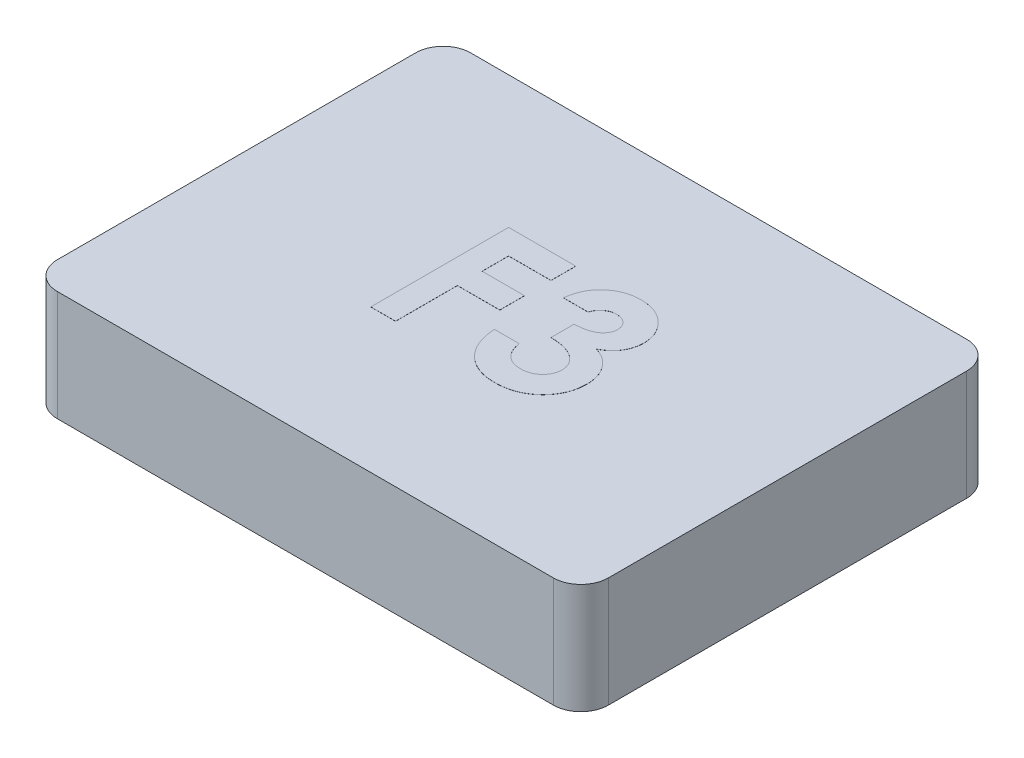
from build123d import *

# Parameters (mm, degrees)
SKETCH1_W           = 12.7
SKETCH1_H           = 9.525
BOSS_EXTRUDE1_DEPTH = 2.54
FILLET1_R           = 0.635
SHELL1_START        = 0.635
SHELL1_OUTLINE_W    = 1.905
SHELL1_OUTLINE_H    = 8.255
SHELL1_DEPTH        = 11.43
SKETCH2_R           = 2.54
BOSS_EXTRUDE2_DEPTH = 1.905
BOSS_EXTRUDE3_DEPTH = 0.00254


# Read off the part's stored shape, not the designer's step: Shell1
with BuildPart() as part:
    # Sketch1 → Boss-Extrude1 (new body)
    with BuildSketch(Plane(origin=(0, 0, 0), x_dir=(1, 0, 0), z_dir=(0, 1, 0))):
        with Locations((6.35, 4.7625)):
            Rectangle(SKETCH1_W, SKETCH1_H)
    extrude(amount=BOSS_EXTRUDE1_DEPTH)

    # Fillet1
    fillet1_edges = [part.edges().sort_by_distance(p)[0] for p in [
        (0, 1.27, -9.525),
        (12.7, 1.27, -9.525),
        (12.7, 1.27, 0),
        (0, 1.27, 0),
    ]]
    fillet(fillet1_edges, radius=FILLET1_R)

    # Shell1 outline → Shell1 (cut)
    with BuildSketch(Plane.YZ.offset(SHELL1_START)):
        with Locations((0.9525, -4.7625)):
            Rectangle(SHELL1_OUTLINE_W, SHELL1_OUTLINE_H)
    extrude(amount=SHELL1_DEPTH, mode=Mode.SUBTRACT)

    # Sketch2 → Boss-Extrude2 (add)
    with BuildSketch(Plane(origin=(0, 1.905, 0), x_dir=(-1, 0, 0), z_dir=(0, -1, 0))):
        with Locations(Location((-6.35, 4.7625, 0), (0, 0, 270))):
            Circle(SKETCH2_R)
    extrude(amount=BOSS_EXTRUDE2_DEPTH)

    # Sketch3 → Boss-Extrude3 (add)
    with BuildSketch(Plane(origin=(0, 2.54, 0), x_dir=(1, 0, 0), z_dir=(0, 1, 0))):
        Polygon((4.557346154, 6.477), (6.104141026, 6.477), (6.104141026, 5.907128205), (5.127217949, 5.907128205), (5.127217949, 5.296551282), (6.104141026, 5.296551282), (6.104141026, 4.726679487), (5.127217949, 4.726679487), (5.127217949, 3.302), (4.557346154, 3.302), align=None)
        with BuildLine():
            Line((7.162474359, 5.703602564), (6.592602564, 5.703602564))
            add(Edge.make_bspline(
                [(6.592602564, 5.703602564), (6.596626076, 5.732088422), (6.604513904, 5.78793306), (6.623388421, 5.868782184), (6.645964381, 5.945473111), (6.674149313, 6.017762976), (6.707205653, 6.085780553), (6.744797255, 6.149759244), (6.787330498, 6.20942444), (6.81993268, 6.245366991), (6.836197316, 6.263298077)],
                knots=[0, 0, 0, 0, 1.111473889, 2.178970933, 3.205615836, 4.199322666, 5.174200091, 6.12565194, 7.064921805, 8, 8, 8, 8], degree=3))
            add(Edge.make_bspline(
                [(6.836197316, 6.263298077), (6.859656898, 6.286956845), (6.905893269, 6.333585791), (6.983159668, 6.39331232), (7.064149124, 6.44500157), (7.150485915, 6.48598118), (7.240826576, 6.519149428), (7.335889528, 6.541428614), (7.435286308, 6.556211051), (7.503112106, 6.557667173), (7.53772476, 6.558410256)],
                knots=[0, 0, 0, 0, 1.01925491, 2.00884431, 2.983262333, 3.955970413, 4.92937149, 5.924503185, 6.940838805, 8, 8, 8, 8], degree=3))
            add(Edge.make_bspline(
                [(7.53772476, 6.558410256), (7.56849719, 6.55768378), (7.628989587, 6.556255673), (7.71789819, 6.544791605), (7.802665103, 6.524684907), (7.884186336, 6.49839585), (7.961262978, 6.462625195), (8.035596185, 6.421103078), (8.105109084, 6.370174475), (8.169964323, 6.31263028), (8.22954623, 6.2503906), (8.281144422, 6.1838615), (8.325504313, 6.114820126), (8.362050997, 6.042692875), (8.39015043, 5.9673577), (8.40965227, 5.8892498), (8.422416697, 5.808541527), (8.423688368, 5.753685202), (8.424333333, 5.725863181)],
                knots=[0, 0, 0, 0, 1.091422571, 2.145516843, 3.172569842, 4.178562979, 5.178154469, 6.181868002, 7.194278174, 8.227918432, 9.254613415, 10.245994977, 11.209837596, 12.161663635, 13.10878368, 14.055455738, 15.013766427, 16, 16, 16, 16], degree=3))
            add(Edge.make_bspline(
                [(8.424333333, 5.725863181), (8.423009825, 5.691407926), (8.420404245, 5.623576121), (8.399023573, 5.524299234), (8.365557006, 5.429372814), (8.317211295, 5.340125024), (8.256766844, 5.256798746), (8.182603526, 5.182179827), (8.096833706, 5.115098345), (8.032445159, 5.079048748), (7.999473558, 5.060588742)],
                knots=[0, 0, 0, 0, 0.992805628, 1.954529043, 2.915727527, 3.886831945, 4.871318353, 5.87440735, 6.911542536, 8, 8, 8, 8], degree=3))
            add(Edge.make_bspline(
                [(7.999473558, 5.060588742), (8.022104759, 5.053158442), (8.066574055, 5.038558236), (8.129781812, 5.009803295), (8.189885167, 4.978378911), (8.245849161, 4.94187206), (8.298230423, 4.901758919), (8.346709632, 4.857696584), (8.391576439, 4.809781133), (8.432098412, 4.757749048), (8.468063246, 4.702432482), (8.500332577, 4.645109215), (8.526892035, 4.584909929), (8.549391202, 4.52252214), (8.566520788, 4.45738514), (8.578581546, 4.389751328), (8.585552961, 4.319774984), (8.58661622, 4.272366053), (8.587153846, 4.248394231)],
                knots=[0, 0, 0, 0, 1.059543567, 2.081955587, 3.086750234, 4.076226789, 5.052108497, 6.020845489, 6.989030705, 7.970690546, 8.952259656, 9.923888338, 10.895517021, 11.877585046, 12.873342345, 13.889638361, 14.932918083, 16, 16, 16, 16], degree=3))
            add(Edge.make_bspline(
                [(8.587153846, 4.248394231), (8.586064006, 4.213165386), (8.583915064, 4.143701278), (8.570253093, 4.041387755), (8.544816966, 3.943840902), (8.511354332, 3.849938294), (8.46671881, 3.760892179), (8.414190304, 3.674659071), (8.349622216, 3.594229511), (8.277865874, 3.517477148), (8.198176272, 3.447697337), (8.111779779, 3.387201381), (8.020576181, 3.335285086), (7.923988457, 3.29313796), (7.822050165, 3.260679852), (7.714988515, 3.237217635), (7.602353665, 3.222863063), (7.525471567, 3.221358258), (7.486207332, 3.220589744)],
                knots=[0, 0, 0, 0, 1.005138573, 1.981928558, 2.936866704, 3.876260664, 4.820238198, 5.773547, 6.751179199, 7.756627054, 8.768222608, 9.766606018, 10.760583154, 11.757261445, 12.767156078, 13.807575856, 14.880313354, 16, 16, 16, 16], degree=3))
            add(Edge.make_bspline(
                [(7.486207332, 3.220589744), (7.449063998, 3.221400012), (7.376435124, 3.222984385), (7.270200196, 3.236697937), (7.169233952, 3.258819009), (7.073278726, 3.290000494), (6.98270576, 3.330437552), (6.896693704, 3.378589014), (6.816958908, 3.437232146), (6.742612971, 3.503719685), (6.67530511, 3.578314929), (6.615147733, 3.659289915), (6.56346732, 3.746952559), (6.52005193, 3.84092833), (6.485240973, 3.941382088), (6.457782192, 4.048109556), (6.438601784, 4.161319247), (6.432760351, 4.239209923), (6.429782051, 4.278923077)],
                knots=[0, 0, 0, 0, 1.066544725, 2.085487077, 3.070979577, 4.031932826, 4.977951092, 5.916076795, 6.857635327, 7.814973522, 8.776389752, 9.738577119, 10.707772778, 11.69409279, 12.707140348, 13.757286496, 14.856535458, 16, 16, 16, 16], degree=3))
            Line((6.429782051, 4.278923077), (6.999653846, 4.278923077))
            add(Edge.make_bspline(
                [(6.999653846, 4.278923077), (7.003265064, 4.258954782), (7.010298859, 4.220061291), (7.024017843, 4.163752162), (7.041895594, 4.111775358), (7.062566722, 4.063668911), (7.084894652, 4.018801199), (7.111872131, 3.978829299), (7.141522391, 3.942667809), (7.184307932, 3.899678631), (7.245472811, 3.855509046), (7.32806566, 3.817123574), (7.419942383, 3.794624972), (7.484173376, 3.791880212), (7.517372196, 3.790461538)],
                knots=[0, 0, 0, 0, 0.928156231, 1.807827665, 2.648129825, 3.438902246, 4.202261636, 4.936546065, 5.639352463, 6.338805438, 7.70633318, 9.064371875, 10.482673459, 12, 12, 12, 12], degree=3))
            add(Edge.make_bspline(
                [(7.517372196, 3.790461538), (7.534988663, 3.790763632), (7.569495381, 3.791355365), (7.620180613, 3.797913931), (7.668465432, 3.808715896), (7.714439772, 3.823395366), (7.758396309, 3.841796999), (7.799495209, 3.865524803), (7.83857417, 3.893111763), (7.875208368, 3.92412683), (7.909059122, 3.95792215), (7.937224941, 3.995344725), (7.96296646, 4.033372751), (7.982005074, 4.074494153), (7.998687001, 4.116496162), (8.008897192, 4.160903319), (8.01660662, 4.206784081), (8.017054661, 4.23818286), (8.017282051, 4.254118389)],
                knots=[0, 0, 0, 0, 1.110435564, 2.175094844, 3.216326037, 4.226890168, 5.215276772, 6.21526065, 7.213097102, 8.228249917, 9.239874822, 10.221364777, 11.178138315, 12.128914389, 13.072518965, 14.022636769, 14.996447288, 16, 16, 16, 16], degree=3))
            add(Edge.make_bspline(
                [(8.017282051, 4.254118389), (8.016678373, 4.271546606), (8.015476588, 4.306242192), (8.005657881, 4.356873103), (7.990152068, 4.40557596), (7.968612599, 4.452135082), (7.939849038, 4.496378862), (7.905908357, 4.539194964), (7.864116592, 4.578354886), (7.818265429, 4.617063282), (7.765096093, 4.65080533), (7.707198004, 4.681944282), (7.643049511, 4.706721274), (7.574216537, 4.728851717), (7.499397041, 4.74501545), (7.419055624, 4.756751894), (7.33332189, 4.765487859), (7.274224512, 4.766741177), (7.243884615, 4.767384615)],
                knots=[0, 0, 0, 0, 0.809814727, 1.612155564, 2.388397, 3.182215007, 3.988903953, 4.837162975, 5.715530372, 6.646997145, 7.623086902, 8.637258368, 9.698941581, 10.815059213, 11.996518529, 13.252603015, 14.589518788, 16, 16, 16, 16], degree=3))
            Line((7.243884615, 4.767384615), (7.243884615, 5.296551282))
            add(Edge.make_bspline(
                [(7.243884615, 5.296551282), (7.281659591, 5.29976832), (7.35232909, 5.30578676), (7.450422144, 5.319861093), (7.53300385, 5.338673756), (7.602059062, 5.361370215), (7.659398085, 5.390518382), (7.709489139, 5.422696672), (7.752629925, 5.460067052), (7.789089675, 5.501515143), (7.818256341, 5.546026507), (7.838898809, 5.592909304), (7.852530015, 5.640712924), (7.853821571, 5.673409158), (7.854461538, 5.689610176)],
                knots=[0, 0, 0, 0, 1.70044513, 3.18119609, 4.440695891, 5.496282586, 6.431922213, 7.318171381, 8.16090191, 8.983045123, 9.787564368, 10.536848927, 11.275007137, 12, 12, 12, 12], degree=3))
            add(Edge.make_bspline(
                [(7.854461538, 5.689610176), (7.853357412, 5.710280916), (7.85120239, 5.750625824), (7.834465326, 5.808367886), (7.805411679, 5.859840149), (7.766455839, 5.9049343), (7.718986794, 5.942600315), (7.663344752, 5.969945199), (7.600737148, 5.98601154), (7.556689325, 5.987677078), (7.533908654, 5.988538462)],
                knots=[0, 0, 0, 0, 1.009664648, 1.970651636, 2.907870547, 3.878035693, 4.867062054, 5.849714035, 6.887914197, 8, 8, 8, 8], degree=3))
            add(Edge.make_bspline(
                [(7.533908654, 5.988538462), (7.513260536, 5.987522119), (7.472288347, 5.985505385), (7.412374743, 5.970453015), (7.355476781, 5.945114223), (7.302772655, 5.910173522), (7.255023163, 5.868211222), (7.215834605, 5.818515587), (7.183239421, 5.764063969), (7.169423181, 5.723835374), (7.162474359, 5.703602564)],
                knots=[0, 0, 0, 0, 0.98818071, 1.960853194, 2.938124878, 3.957524365, 4.978590984, 5.968022688, 6.978025184, 8, 8, 8, 8], degree=3))
        make_face()
    extrude(amount=BOSS_EXTRUDE3_DEPTH)


solid = part.part
